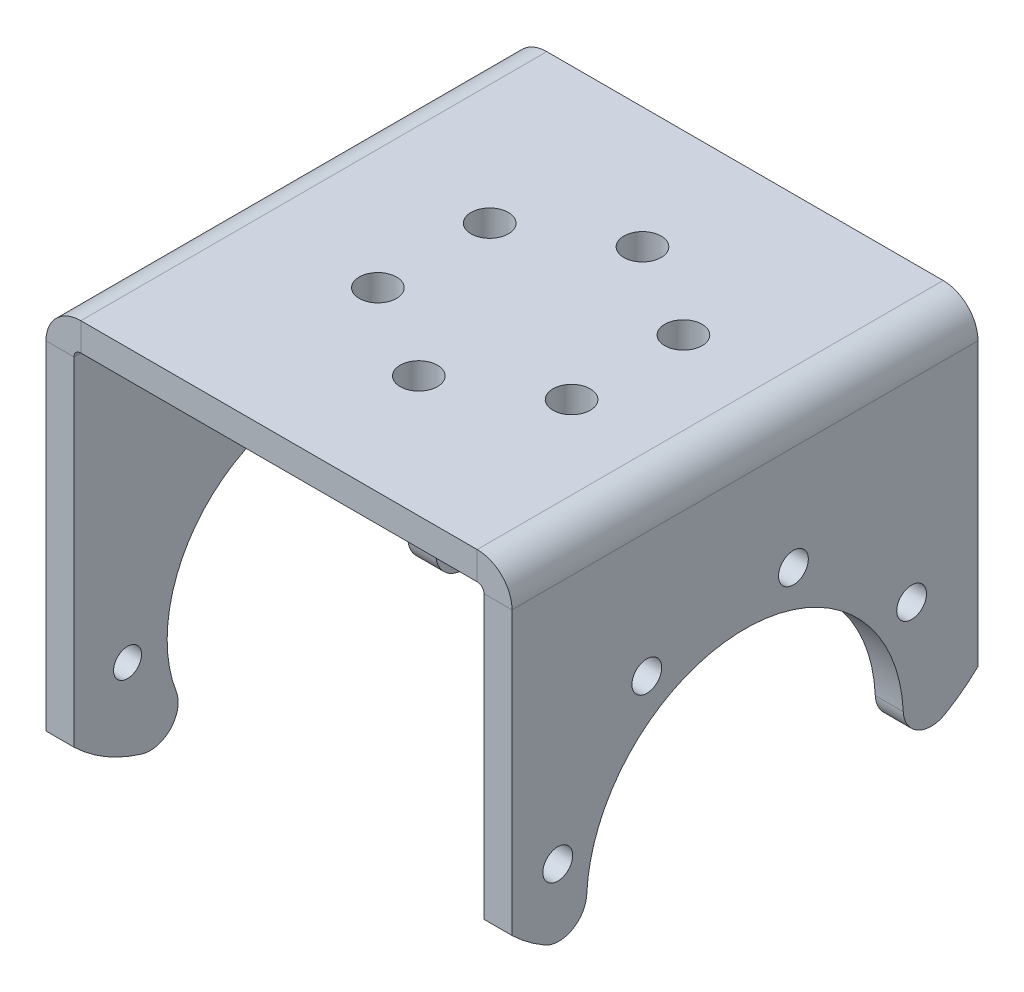
from build123d import *

# Parameters (mm, degrees)
SKETCH_1_W                       = 44
SKETCH_1_H                       = 50
SKETCH_1_R                       = 2
SM_BASE_FLANGE_1_DEPTH           = 3
SM_EDGE_FLANGE_1_STRIP_W         = 13.4732
SM_EDGE_FLANGE_1_STRIP_H         = 3
SM_EDGE_FLANGE_1_STRIP_CUT_DEPTH = 50
SM_EDGE_FLANGE_1_DEPTH           = 50
SM_EDGE_FLANGE_2_STRIP_W         = 13.4732
SM_EDGE_FLANGE_2_STRIP_H         = 3
SM_EDGE_FLANGE_2_STRIP_CUT_DEPTH = 50
SM_EDGE_FLANGE_2_DEPTH           = 50
SKETCH_15_R                      = 15
SKETCH_15_R_2                    = 1.5
CUT_EXTRUDE_1_DEPTH              = 3
SKETCH_16_R                      = 1.6
SKETCH_16_R_2                    = 17
CUT_EXTRUDE_2_DEPTH              = 3
CUT_EXTRUDE_5_DEPTH              = 3
SKETCH_18_R                      = 1.6
CUT_EXTRUDE_6_DEPTH              = 3
FILLET_2_R                       = 3
CUT_EXTRUDE_7_DEPTH              = 10


# Sheet-metal steps are written as plain solids
with BuildPart() as part:
    # Sketch 1 → 基体-法兰1 (new body)
    with BuildSketch(Plane(origin=(0, 0, 0), x_dir=(1, 0, 0), z_dir=(0, 1, 0))):
        with Locations((-2, 0)):
            Rectangle(SKETCH_1_W, SKETCH_1_H)
        with Locations(Location((0, 12, 0), (0, 0, 270))):
            Circle(SKETCH_1_R, mode=Mode.SUBTRACT)
        with Locations(Location((10.392304845, 6, 0), (0, 0, 270))):
            Circle(SKETCH_1_R, mode=Mode.SUBTRACT)
        with Locations(Location((10.392304845, -6, 0), (0, 0, 270))):
            Circle(SKETCH_1_R, mode=Mode.SUBTRACT)
        with Locations(Location((0, -12, 0), (0, 0, 270))):
            Circle(SKETCH_1_R, mode=Mode.SUBTRACT)
        with Locations(Location((-10.392304845, -6, 0), (0, 0, 270))):
            Circle(SKETCH_1_R, mode=Mode.SUBTRACT)
        with Locations(Location((-10.392304845, 6, 0), (0, 0, 270))):
            Circle(SKETCH_1_R, mode=Mode.SUBTRACT)
    extrude(amount=-SM_BASE_FLANGE_1_DEPTH)

    # 边线-法兰1 strip (across the edge) → 边线-法兰1 strip cut (cut)
    with BuildSketch(Plane(origin=(20, -3, -25), x_dir=(-1, 0, 0), z_dir=(0, 0, 1))):
        with Locations((-6, -1.5)):
            Rectangle(SM_EDGE_FLANGE_1_STRIP_W, SM_EDGE_FLANGE_1_STRIP_H)
    extrude(amount=SM_EDGE_FLANGE_1_STRIP_CUT_DEPTH, mode=Mode.SUBTRACT)

    # 边线-法兰1 section (across the edge) → 边线-法兰1 (add)
    with BuildSketch(Plane(origin=(20, -3, -25), x_dir=(-1, 0, 0), z_dir=(0, 0, 1))):
        with BuildLine():
            Line((-3, 0.7366), (-3, 57))
            Line((-3, 57), (0, 57))
            Line((0, 57), (0, 0.7366))
            ThreePointArc((0, 0.7366), (0.215745145, 0.215745145), (0.7366, 0))
            Line((0.7366, 0), (0.7366, -3))
            ThreePointArc((0.7366, -3), (-1.905575199, -1.905575199), (-3, 0.7366))
        make_face()
    extrude(amount=SM_EDGE_FLANGE_1_DEPTH)

    # 边线-法兰2 strip (across the edge) → 边线-法兰2 strip cut (cut)
    with BuildSketch(Plane(origin=(-24, -3, 25), x_dir=(1, 0, 0), z_dir=(0, 0, -1))):
        with Locations((-6, -1.5)):
            Rectangle(SM_EDGE_FLANGE_2_STRIP_W, SM_EDGE_FLANGE_2_STRIP_H)
    extrude(amount=SM_EDGE_FLANGE_2_STRIP_CUT_DEPTH, mode=Mode.SUBTRACT)

    # 边线-法兰2 section (across the edge) → 边线-法兰2 (add)
    with BuildSketch(Plane(origin=(-24, -3, 25), x_dir=(1, 0, 0), z_dir=(0, 0, -1))):
        with BuildLine():
            Line((-3, 0.7366), (-3, 57))
            Line((-3, 57), (0, 57))
            Line((0, 57), (0, 0.7366))
            ThreePointArc((0, 0.7366), (0.215745145, 0.215745145), (0.7366, 0))
            Line((0.7366, 0), (0.7366, -3))
            ThreePointArc((0.7366, -3), (-1.905575199, -1.905575199), (-3, 0.7366))
        make_face()
    extrude(amount=SM_EDGE_FLANGE_2_DEPTH)

    # 草图15 → 切除-拉伸1 (cut)
    with BuildSketch(Plane.ZY.offset(27)):
        with Locations(Location((0, -35, 0), (0, 0, 270))):
            Circle(SKETCH_15_R)
        with Locations(Location((0, -15.75, 0), (0, 0, 270))):
            Circle(SKETCH_15_R_2)
        with Locations(Location((19.25, -35, 0), (0, 0, 270))):
            Circle(SKETCH_15_R_2)
        with Locations(Location((0, -54.25, 0), (0, 0, 270))):
            Circle(SKETCH_15_R_2)
        with Locations(Location((-19.25, -35, 0), (0, 0, 270))):
            Circle(SKETCH_15_R_2)
    extrude(amount=-CUT_EXTRUDE_1_DEPTH, mode=Mode.SUBTRACT)

    # 草图16 → 切除-拉伸2 (cut)
    with BuildSketch(Plane(origin=(23, 0, 0), x_dir=(0, 0, -1), z_dir=(1, 0, 0))):
        with Locations(Location((17.878805079, -24.468578969, 0), (0, 0, 90))):
            Circle(SKETCH_16_R)
        with Locations(Location((20.089063538, -40.195385084, 0), (0, 0, 90))):
            Circle(SKETCH_16_R)
        with Locations(Location((10.531421031, -52.878805079, 0), (0, 0, 90))):
            Circle(SKETCH_16_R)
        with BuildLine():
            ThreePointArc((-3.595385084, -55.089063538), (-4.993466734, -53.501855618), (-6.744421309, -54.688455531))
            ThreePointArc((-6.744421309, -54.688455531), (-5.595993091, -56.638099762), (-3.64634886, -55.489671544))
            ThreePointArc((-3.64634886, -55.489671544), (-3.608177165, -55.290981888), (-3.595385084, -55.089063538))
        make_face()
        with Locations(Location((-17.878805079, -45.531421031, 0), (0, 0, 90))):
            Circle(SKETCH_16_R)
        with Locations(Location((-20.089063538, -29.804614916, 0), (0, 0, 90))):
            Circle(SKETCH_16_R)
        with Locations(Location((-10.531421031, -17.121194921, 0), (0, 0, 90))):
            Circle(SKETCH_16_R)
        with Locations(Location((5.195385084, -14.910936462, 0), (0, 0, 90))):
            Circle(SKETCH_16_R)
        with Locations(Location((0, -35, 0), (0, 0, 90))):
            Circle(SKETCH_16_R_2)
    extrude(amount=-CUT_EXTRUDE_2_DEPTH, mode=Mode.SUBTRACT)

    # 草图17 → 切除-拉伸5 (cut)
    with BuildSketch(Plane.ZY.offset(27)):
        with BuildLine():
            ThreePointArc((0, -50), (-6.123724357, -48.693063938), (-11.180339887, -45))
            ThreePointArc((-11.180339887, -45), (-18.623701364, -43.974644577), (-25, -40))
            Line((-25, -40), (-25, -60))
            Line((-25, -60), (0, -60))
            Line((0, -60), (0, -55.75))
            ThreePointArc((0, -55.75), (-1.5, -54.25), (0, -52.75))
            Line((0, -52.75), (0, -50))
        make_face()
        with BuildLine():
            Line((25, -60), (25, -40))
            ThreePointArc((25, -40), (18.623701364, -43.974644577), (11.180339887, -45))
            ThreePointArc((11.180339887, -45), (6.123724357, -48.693063938), (0, -50))
            Line((0, -50), (0, -52.75))
            ThreePointArc((0, -52.75), (1.060660172, -53.189339828), (1.5, -54.25))
            ThreePointArc((1.5, -54.25), (1.060660172, -55.310660172), (0, -55.75))
            Line((0, -55.75), (0, -60))
            Line((0, -60), (25, -60))
        make_face()
        with BuildLine():
            ThreePointArc((15, -35), (10.606601718, -24.393398282), (0, -20))
            Line((0, -20), (0, -45))
            Line((0, -45), (11.180339887, -45))
            ThreePointArc((11.180339887, -45), (14.012585384, -40.352331347), (15, -35))
        make_face()
        with BuildLine():
            Line((0, -45), (0, -20))
            ThreePointArc((0, -20), (-13.693063938, -28.876275643), (-11.180339887, -45))
            Line((-11.180339887, -45), (0, -45))
        make_face()
        with BuildLine():
            Line((11.180339887, -45), (0, -45))
            Line((0, -45), (0, -50))
            ThreePointArc((0, -50), (6.123724357, -48.693063938), (11.180339887, -45))
        make_face()
        with BuildLine():
            Line((0, -50), (0, -45))
            Line((0, -45), (-11.180339887, -45))
            ThreePointArc((-11.180339887, -45), (-6.123724357, -48.693063938), (0, -50))
        make_face()
    extrude(amount=-CUT_EXTRUDE_5_DEPTH, mode=Mode.SUBTRACT)

    # 草图18 → 切除-拉伸6 (cut)
    # profile 1 of 5: a face of its own
    with BuildSketch(Plane(origin=(23, 0, 0), x_dir=(0, 0, -1), z_dir=(1, 0, 0))):
        with BuildLine():
            ThreePointArc((13.743814378, -45.005376871), (0, -52), (-13.743814378, -45.005376871))
            ThreePointArc((-13.743814378, -45.005376871), (-15.17808001, -44.848040907), (-16.595135856, -44.576332908))
            ThreePointArc((-16.595135856, -44.576332908), (-16.359945185, -45.028365745), (-16.278805079, -45.531421031))
            ThreePointArc((-16.278805079, -45.531421031), (-18.786243203, -46.849205555), (-18.449500144, -44.036661137))
            ThreePointArc((-18.449500144, -44.036661137), (-21.942963359, -42.372436612), (-25, -40))
            Line((-25, -40), (-25, -60))
            Line((-25, -60), (25, -60))
            Line((25, -60), (25, -40))
            ThreePointArc((25, -40), (19.81343454, -43.495603445), (13.743814378, -45.005376871))
        make_face()
        with Locations((-5.195385084, -55.089063538)):
            Circle(SKETCH_18_R, mode=Mode.SUBTRACT)
        with Locations((10.531421031, -52.878805079)):
            Circle(SKETCH_18_R, mode=Mode.SUBTRACT)
    # profile 2 of 5: a face of its own
    with BuildSketch(Plane(origin=(23, 0, 0), x_dir=(0, 0, -1), z_dir=(1, 0, 0))):
        with BuildLine():
            Line((11.180339887, -45), (-11.180339887, -45))
            ThreePointArc((-11.180339887, -45), (-12.461981292, -45.048381264), (-13.743814378, -45.005376871))
            ThreePointArc((-13.743814378, -45.005376871), (0, -52), (13.743814378, -45.005376871))
            ThreePointArc((13.743814378, -45.005376871), (12.461981292, -45.048381264), (11.180339887, -45))
        make_face()
    # profile 3 of 5: a face of its own
    with BuildSketch(Plane(origin=(23, 0, 0), x_dir=(0, 0, -1), z_dir=(1, 0, 0))):
        with BuildLine():
            ThreePointArc((-16.595135856, -44.576332908), (-15.17808001, -44.848040907), (-13.743814378, -45.005376871))
            ThreePointArc((-13.743814378, -45.005376871), (-15.519532338, -41.938596112), (-16.620858499, -38.570302896))
            ThreePointArc((-16.620858499, -38.570302896), (-21.118873978, -36.850650515), (-25, -34))
            Line((-25, -34), (-25, -40))
            ThreePointArc((-25, -40), (-21.942963359, -42.372436612), (-18.449500144, -44.036661137))
            ThreePointArc((-18.449500144, -44.036661137), (-17.431709516, -43.995157526), (-16.595135856, -44.576332908))
        make_face()
    # profile 4 of 5: a face of its own
    with BuildSketch(Plane(origin=(23, 0, 0), x_dir=(0, 0, -1), z_dir=(1, 0, 0))):
        with BuildLine():
            ThreePointArc((-13.743814378, -45.005376871), (-12.461981292, -45.048381264), (-11.180339887, -45))
            Line((-11.180339887, -45), (11.180339887, -45))
            ThreePointArc((11.180339887, -45), (12.461981292, -45.048381264), (13.743814378, -45.005376871))
            ThreePointArc((13.743814378, -45.005376871), (15.519532338, -41.938596112), (16.620858499, -38.570302896))
            ThreePointArc((16.620858499, -38.570302896), (13.916978953, -38.992540305), (11.180339887, -39))
            Line((11.180339887, -39), (-11.180339887, -39))
            ThreePointArc((-11.180339887, -39), (-13.916978953, -38.992540305), (-16.620858499, -38.570302896))
            ThreePointArc((-16.620858499, -38.570302896), (-15.519532338, -41.938596112), (-13.743814378, -45.005376871))
        make_face()
    # profile 5 of 5: a face of its own
    with BuildSketch(Plane(origin=(23, 0, 0), x_dir=(0, 0, -1), z_dir=(1, 0, 0))):
        with BuildLine():
            ThreePointArc((16.620858499, -38.570302896), (15.519532338, -41.938596112), (13.743814378, -45.005376871))
            ThreePointArc((13.743814378, -45.005376871), (19.81343454, -43.495603445), (25, -40))
            Line((25, -40), (25, -34))
            ThreePointArc((25, -34), (21.118873978, -36.850650515), (16.620858499, -38.570302896))
        make_face()
        with Locations((20.089063538, -40.195385084)):
            Circle(SKETCH_18_R, mode=Mode.SUBTRACT)
    extrude(amount=-CUT_EXTRUDE_6_DEPTH, mode=Mode.SUBTRACT)

    # 圆角2
    fillet_2_edges = [part.edges().sort_by_distance(p)[0] for p in [
        (-25.5, -45, 11.180339887),
        (-25.5, -45, -11.180339887),
        (21.5, -38.570302896, -16.620858499),
        (21.5, -38.570302896, 16.620858499),
    ]]
    fillet(fillet_2_edges, radius=FILLET_2_R)

    # 草图19 → 切除-拉伸7 (cut)
    with BuildSketch(Plane.ZY.offset(27)):
        with BuildLine():
            Line((-7.5, -5.5), (7.5, -5.5))
            ThreePointArc((7.5, -5.5), (10.5, -8.5), (7.5, -11.5))
            Line((7.5, -11.5), (-7.5, -11.5))
            ThreePointArc((-7.5, -11.5), (-10.5, -8.5), (-7.5, -5.5))
        make_face()
    extrude(amount=-CUT_EXTRUDE_7_DEPTH, mode=Mode.SUBTRACT)


solid = part.part
